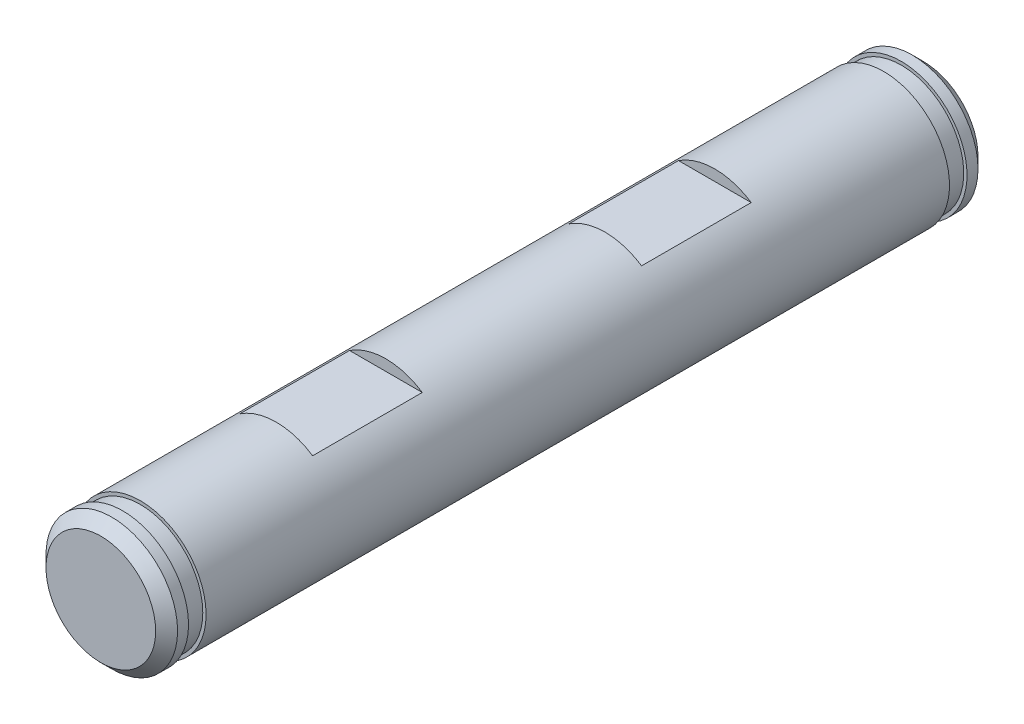
from build123d import *

# Parameters (mm, degrees)
SZKIC1_R                    = 3
DODANIE_WYCI_GNI_CIE1_DEPTH = 37.5
SFAZOWANIE1_SIZE            = 0.5
WYTNIJ_WYCI_GNI_CIE1_START  = -1.8
SZKIC2_R                    = 3
SZKIC2_R_2                  = 2.85
WYTNIJ_WYCI_GNI_CIE1_DEPTH  = 0.8
WYTNIJ_WYCI_GNI_CIE2_START  = -1
SZKIC3_R                    = 3
SZKIC3_R_2                  = 2.85
WYTNIJ_WYCI_GNI_CIE2_DEPTH  = 0.8
WYTNIJ_WYCI_GNI_CIE3_START  = -13
WYTNIJ_WYCI_GNI_CIE3_DEPTH  = 5
WYTNIJ_WYCI_GNI_CIE4_START  = -28
WYTNIJ_WYCI_GNI_CIE4_DEPTH  = 5


with BuildPart() as part:
    # Szkic1 → Dodanie-wyciągnięcie1 (new body)
    with BuildSketch(Plane.XY):
        Circle(SZKIC1_R)
    extrude(amount=DODANIE_WYCI_GNI_CIE1_DEPTH)

    # Sfazowanie1
    sfazowanie1_edges = [part.edges().sort_by_distance(p)[0] for p in [
        (-3, 0, 0),
        (-3, 0, 37.5),
    ]]
    chamfer(sfazowanie1_edges, length=SFAZOWANIE1_SIZE)

    # Szkic2 → Wytnij-wyciągnięcie1 (cut)
    with BuildSketch(Plane.XY.offset(37.5).offset(WYTNIJ_WYCI_GNI_CIE1_START)):
        Circle(SZKIC2_R)
        Circle(SZKIC2_R_2, mode=Mode.SUBTRACT)
    extrude(amount=WYTNIJ_WYCI_GNI_CIE1_DEPTH, mode=Mode.SUBTRACT)

    # Szkic3 → Wytnij-wyciągnięcie2 (cut)
    with BuildSketch(Plane(origin=(0, 0, 0), x_dir=(-1, 0, 0), z_dir=(0, 0, -1)).offset(WYTNIJ_WYCI_GNI_CIE2_START)):
        Circle(SZKIC3_R)
        Circle(SZKIC3_R_2, mode=Mode.SUBTRACT)
    extrude(amount=-WYTNIJ_WYCI_GNI_CIE2_DEPTH, mode=Mode.SUBTRACT)

    # Szkic4 → Wytnij-wyciągnięcie3 (cut)
    with BuildSketch(Plane.XY.offset(37.5).offset(WYTNIJ_WYCI_GNI_CIE3_START)):
        with BuildLine():
            Line((-1.658312395, 2.5), (1.658312395, 2.5))
            ThreePointArc((1.658312395, 2.5), (0, 3), (-1.658312395, 2.5))
        make_face()
    extrude(amount=WYTNIJ_WYCI_GNI_CIE3_DEPTH, mode=Mode.SUBTRACT)

    # Szkic4<2> → Wytnij-wyciągnięcie4 (cut)
    with BuildSketch(Plane.XY.offset(37.5).offset(WYTNIJ_WYCI_GNI_CIE4_START)):
        with BuildLine():
            Line((-1.658312395, 2.5), (1.658312395, 2.5))
            ThreePointArc((1.658312395, 2.5), (0, 3), (-1.658312395, 2.5))
        make_face()
    extrude(amount=WYTNIJ_WYCI_GNI_CIE4_DEPTH, mode=Mode.SUBTRACT)


solid = part.part
